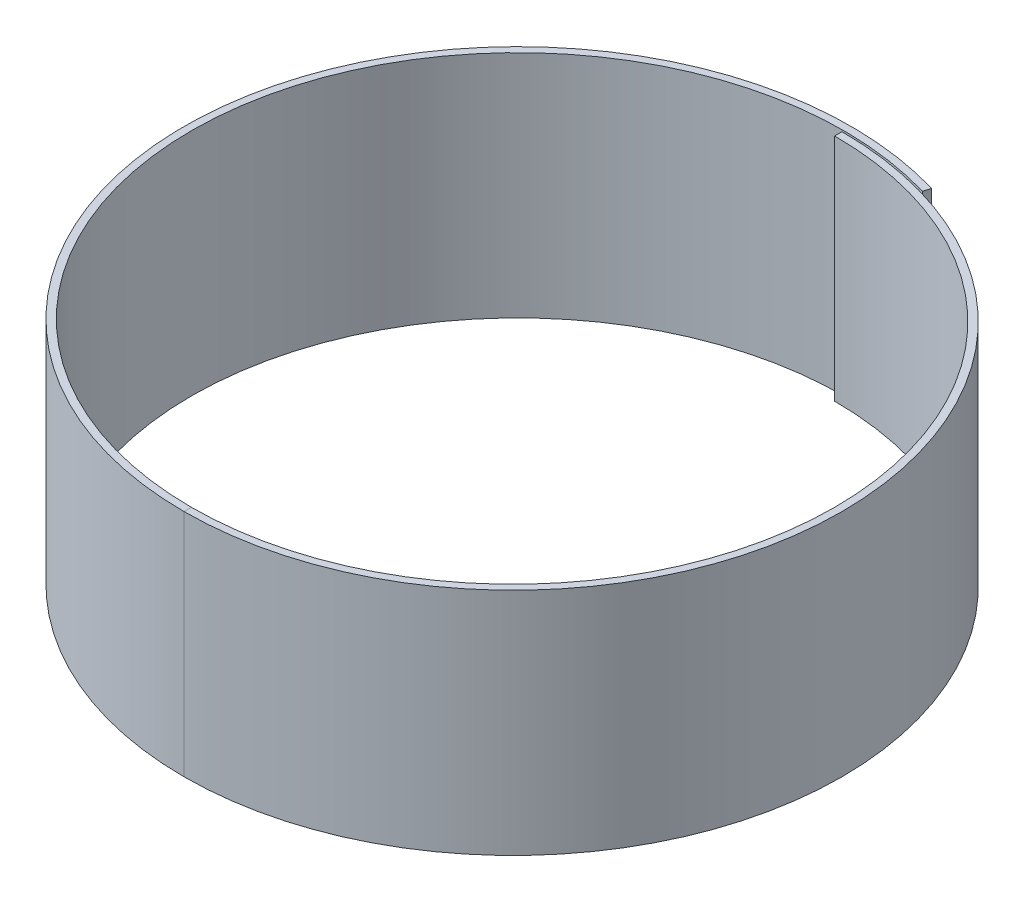
from build123d import *

# Parameters (mm, degrees)
BRIDA_BASE1_DEPTH = 25


# Sheet-metal steps are written as plain solids
with BuildPart() as part:
    # Croquis1 → Brida base1 (new body)
    with BuildSketch(Plane(origin=(0, 0, 0), x_dir=(1, 0, 0), z_dir=(0, 1, 0))):
        with BuildLine():
            ThreePointArc((9.990543733, 34.065217391), (-35.139473654, 5.046522694), (0, -35.5))
            ThreePointArc((0, -35.5), (35, -0.5), (0, 34.5))
            Line((0, 34.5), (0, 35.3))
            ThreePointArc((0, 35.3), (35.8, -0.5), (0, -36.3))
            ThreePointArc((0, -36.3), (-35.931349117, 5.160247149), (10.215682747, 34.832884262))
            Line((10.215682747, 34.832884262), (9.990543733, 34.065217391))
        make_face()
    extrude(amount=BRIDA_BASE1_DEPTH)


solid = part.part
